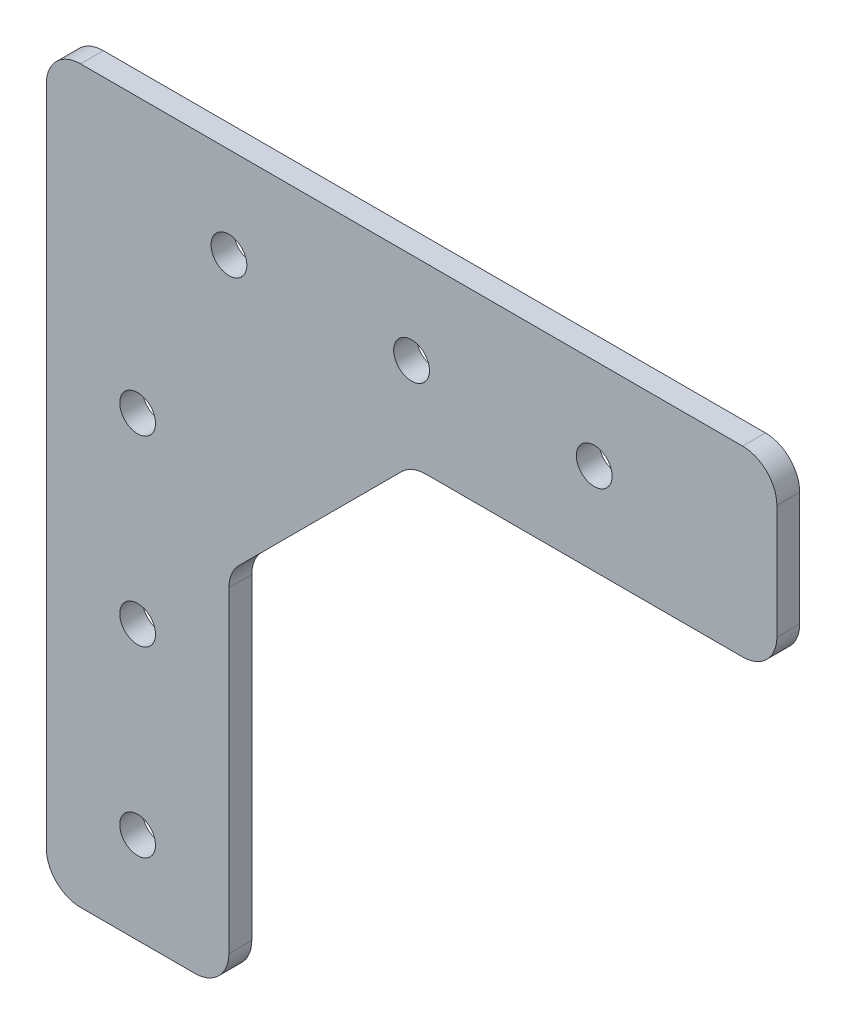
from build123d import *

# Parameters (mm, degrees)
SKETCH1_R           = 2.4892
BOSS_EXTRUDE1_DEPTH = 1.5875
FILLET1_R           = 4.7625


with BuildPart() as part:
    # Sketch1 → Boss-Extrude1 (new, symmetric)
    with BuildSketch(Plane.XY):
        Polygon((0, 101.6), (0, 0), (25.4, 0), (25.4, 50.8), (50.8, 76.2), (101.6, 76.2), (101.6, 101.6), align=None)
        with Locations((12.7, 63.5)):
            Circle(SKETCH1_R, mode=Mode.SUBTRACT)
        with Locations((12.7, 38.1)):
            Circle(SKETCH1_R, mode=Mode.SUBTRACT)
        with Locations((12.7, 12.7)):
            Circle(SKETCH1_R, mode=Mode.SUBTRACT)
        with Locations((25.4, 88.9)):
            Circle(SKETCH1_R, mode=Mode.SUBTRACT)
        with Locations((50.8, 88.9)):
            Circle(SKETCH1_R, mode=Mode.SUBTRACT)
        with Locations((76.2, 88.9)):
            Circle(SKETCH1_R, mode=Mode.SUBTRACT)
    extrude(amount=BOSS_EXTRUDE1_DEPTH, both=True)

    # Fillet1
    fillet1_edges = [part.edges().sort_by_distance(p)[0] for p in [
        (0, 101.6, 0),
        (0, 0, 0),
        (101.6, 76.2, 0),
        (50.8, 76.2, 0),
        (25.4, 50.8, 0),
        (25.4, 0, 0),
        (101.6, 101.6, 0),
    ]]
    fillet(fillet1_edges, radius=FILLET1_R)


solid = part.part
